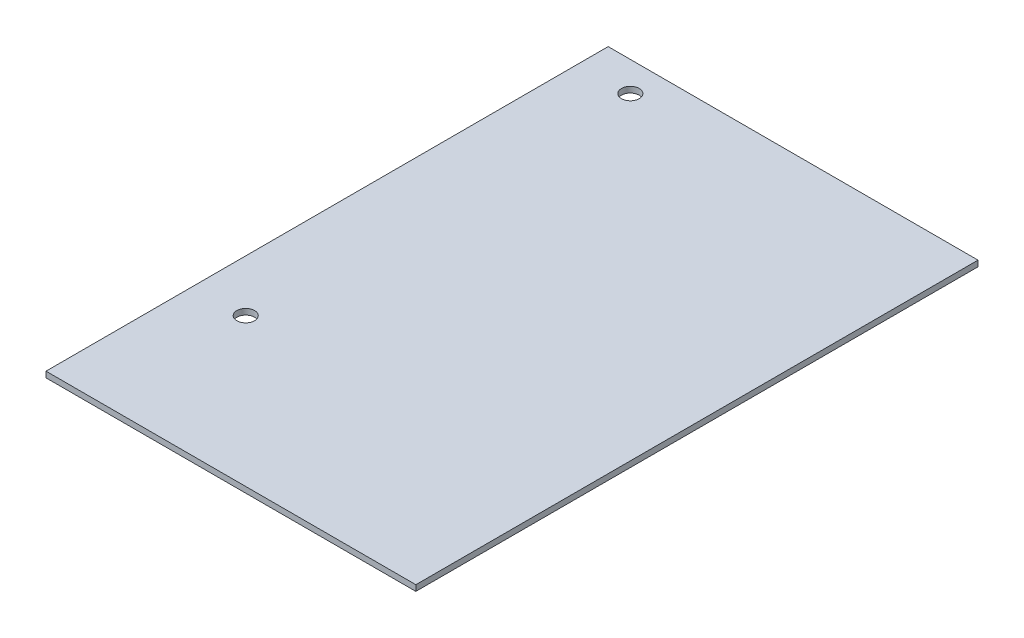
from build123d import *

# Parameters (mm, degrees)
SKETCH1_W              = 63.5
SKETCH1_H              = 96.52
BOSS_EXTRUDE1_DEPTH    = 1
SKETCH2_R              = 1.524
MOUNTING_HOLES_1_DEPTH = 2
SKETCH3_R              = 1.524
MOUNTING_HOLES_2_DEPTH = 3


with BuildPart() as part:
    # Sketch1 → Boss-Extrude1 (new body)
    with BuildSketch(Plane(origin=(0, 0, 0), x_dir=(1, 0, 0), z_dir=(0, 1, 0))):
        with Locations((31.75, 48.26)):
            Rectangle(SKETCH1_W, SKETCH1_H)
    extrude(amount=BOSS_EXTRUDE1_DEPTH)

    # Sketch2 → mounting holes (1) (cut)
    with BuildSketch(Plane(origin=(0, 1, 0), x_dir=(1, 0, 0), z_dir=(0, 1, 0))):
        with Locations((8.89, 91.44)):
            Circle(SKETCH2_R)
    extrude(amount=-MOUNTING_HOLES_1_DEPTH, mode=Mode.SUBTRACT)

    # Sketch3 → mounting holes (2) (cut)
    with BuildSketch(Plane(origin=(0, 1, 0), x_dir=(1, 0, 0), z_dir=(0, 1, 0))):
        with Locations((8.89, 25.4)):
            Circle(SKETCH3_R)
    extrude(amount=-MOUNTING_HOLES_2_DEPTH, mode=Mode.SUBTRACT)


solid = part.part
